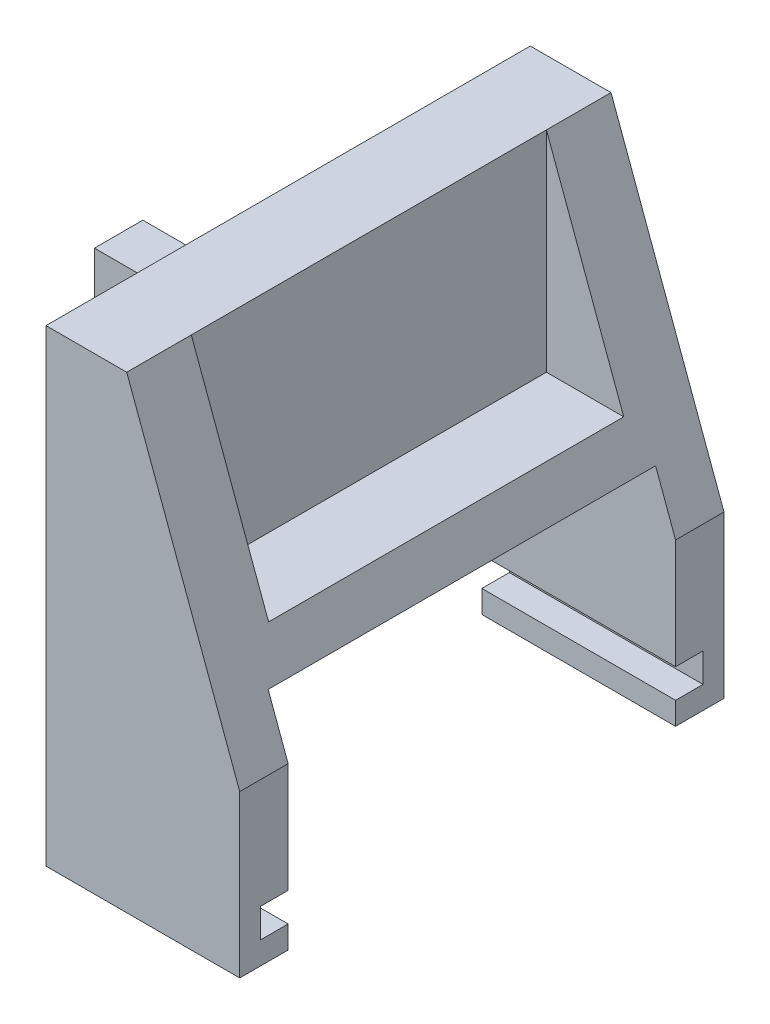
from build123d import *

# Parameters (mm, degrees)
BOSS_EXTRUDE1_DEPTH = 30
SKETCH4_W           = 24
SKETCH4_H           = 14
CUT_EXTRUDE2_DEPTH  = 25
SKETCH5_W           = 1.7
SKETCH5_H           = 1.8
CUT_EXTRUDE3_DEPTH  = 15
CUT_EXTRUDE4_DEPTH  = 11
BOSS_EXTRUDE2_DEPTH = 3


with BuildPart() as part:
    # Sketch1 → Boss-Extrude1 (new body)
    with BuildSketch(Plane.XY):
        Polygon((0, 0), (0, -29), (12, -29), (12, -19), (5, 0), align=None)
    extrude(amount=-BOSS_EXTRUDE1_DEPTH)

    # Sketch4 → Cut-Extrude2 (cut)
    with BuildSketch(Plane.ZY):
        with Locations((-15, -22.638599401)):
            Rectangle(SKETCH4_W, SKETCH4_H)
    extrude(amount=-CUT_EXTRUDE2_DEPTH, mode=Mode.SUBTRACT)

    # Sketch5 → Cut-Extrude3 (cut)
    with BuildSketch(Plane.ZY):
        with Locations((-2.15, -26.7)):
            Rectangle(SKETCH5_W, SKETCH5_H)
    cut_extrude3 = extrude(amount=-CUT_EXTRUDE3_DEPTH, mode=Mode.SUBTRACT)

    # Mirror1: Cut-Extrude3 across plane
    add(cut_extrude3.mirror(Plane.XY.offset(-15)), mode=Mode.SUBTRACT)

    # Sketch6 → Cut-Extrude4 (cut, symmetric)
    with BuildSketch(Plane.XY.offset(-15)):
        Polygon((5, 0), (5, -13), (9.789473684, -13), align=None)
    extrude(amount=CUT_EXTRUDE4_DEPTH, both=True, mode=Mode.SUBTRACT)

    # Sketch7 → Boss-Extrude2 (add)
    with BuildSketch(Plane(origin=(0, -15, 0), x_dir=(1, 0, 0), z_dir=(0, 1, 0))):
        Polygon((0, 15), (-5, 15), (-10.656854249, 20.656854249), (-14.656854249, 20.656854249), (-14.656854249, 17.656854249), (-11.899494937, 17.656854249), (-6.242640687, 12), (0, 12), align=None)
    extrude(amount=BOSS_EXTRUDE2_DEPTH)


solid = part.part
